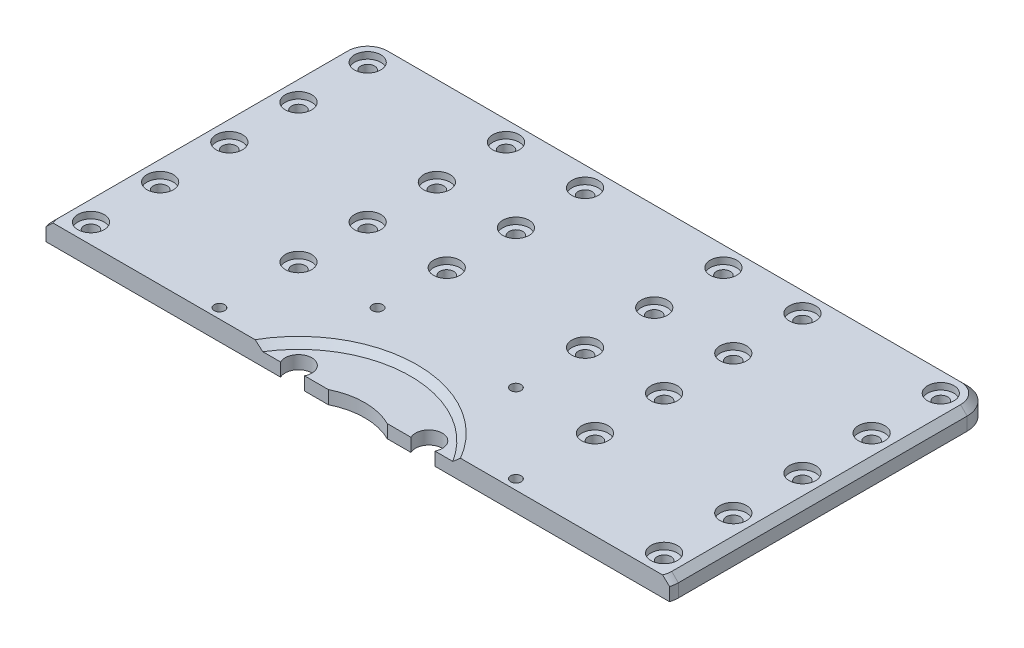
from build123d import *

# Parameters (mm, degrees)
EXTRUDE_1_DEPTH               = 3
HOLE_WIZARD_M2_1_AT_2_COUNT   = 2
HOLE_WIZARD_M2_1_AT_2_PITCH   = 21
PATTERN_LINEAR_1_COUNT        = 3
PATTERN_LINEAR_1_PITCH        = 33
PATTERN_LINEAR_2_COUNT        = 3
PATTERN_LINEAR_2_PITCH        = 10.5
PATTERN_LINEAR_3_COUNT        = 2
PATTERN_LINEAR_3_PITCH        = 31.5
HOLE_WIZARD_M2_1_2_AT_2_COUNT = 2
HOLE_WIZARD_M2_1_2_AT_2_PITCH = 16.970562748
SKETCH_8_R                    = 17
CUT_EXTRUDE_1_DEPTH           = 1
SKETCH_9_R                    = 2.025
CUT_EXTRUDE_2_DEPTH           = 75.994999833
PATTERN_CIRCULAR_1_COUNT      = 2
PATTERN_CIRCULAR_1_ANGLE      = 90
FILLET_1_R                    = 4
CHAMFER_1_SIZE                = 1
SKETCH_11_W                   = 95
SKETCH_11_H                   = 18
CUT_EXTRUDE_3_DEPTH           = 76.028327984


with BuildPart() as part:
    # ｽｹｯﾁ1 → ﾎﾞｽ - 押し出し1 (new body)
    with BuildSketch(Plane(origin=(0, 0, 0), x_dir=(1, 0, 0), z_dir=(0, 1, 0))):
        with BuildLine():
            Line((-10.05, 0), (-39, 0))
            Line((-39, 0), (-47.5, 8.5))
            Line((-47.5, 8.5), (-47.5, 58))
            Line((-47.5, 58), (47.5, 58))
            Line((47.5, 58), (47.5, 8.5))
            Line((47.5, 8.5), (39, 0))
            Line((39, 0), (10.05, 0))
            ThreePointArc((10.05, 0), (0, 10.05), (-10.05, 0))
        make_face()
    extrude(amount=EXTRUDE_1_DEPTH)

    # ｽｹｯﾁ3 → Hole Wizard M2 _1 (revolve, cut)
    with BuildSketch(Plane(origin=(-43.5, 3, -54), x_dir=(0, 0, 1), z_dir=(1, 0, 0))):
        Polygon((0, 0), (0, 4.63090365), (1.05, 4), (1.05, 1), (2, 1), (2, 0), align=None)
    hole_wizard_m2_1 = revolve(axis=Axis((-43.5, 9.35, -54), (0, -1, 0)), mode=Mode.SUBTRACT)

    # Hole Wizard M2 _1 at 2: Hole Wizard M2 _1 ×2
    with Locations(*[(i * HOLE_WIZARD_M2_1_AT_2_PITCH, 0, 0) for i in range(1, HOLE_WIZARD_M2_1_AT_2_COUNT)]):
        add(hole_wizard_m2_1, mode=Mode.SUBTRACT)

    # 直線ﾊﾟﾀｰﾝ1: Hole Wizard M2 _1 ×3
    with Locations(*[(i * PATTERN_LINEAR_1_PITCH, 0, 0) for i in range(1, PATTERN_LINEAR_1_COUNT)]):
        add(hole_wizard_m2_1, mode=Mode.SUBTRACT)

    # 直線ﾊﾟﾀｰﾝ1 copy 1 sketch → 直線ﾊﾟﾀｰﾝ1 copy 1 (revolve, cut)
    with BuildSketch(Plane(origin=(10.5, 3, -54), x_dir=(0, 0, 1), z_dir=(1, 0, 0))):
        Polygon((0, 0), (0, 4.63090365), (1.05, 4), (1.05, 1), (2, 1), (2, 0), align=None)
    revolve(axis=Axis((10.5, 9.35, -54), (0, -1, 0)), mode=Mode.SUBTRACT)

    # 直線ﾊﾟﾀｰﾝ1 copy 2 sketch → 直線ﾊﾟﾀｰﾝ1 copy 2 (revolve, cut)
    with BuildSketch(Plane(origin=(43.5, 3, -54), x_dir=(0, 0, 1), z_dir=(1, 0, 0))):
        Polygon((0, 0), (0, 4.63090365), (1.05, 4), (1.05, 1), (2, 1), (2, 0), align=None)
    revolve(axis=Axis((43.5, 9.35, -54), (0, -1, 0)), mode=Mode.SUBTRACT)

    # 直線ﾊﾟﾀｰﾝ2: Hole Wizard M2 _1 ×3
    with Locations(*[(0, 0, i * PATTERN_LINEAR_2_PITCH) for i in range(1, PATTERN_LINEAR_2_COUNT)]):
        add(hole_wizard_m2_1, mode=Mode.SUBTRACT)

    # 直線ﾊﾟﾀｰﾝ2 copy 1 sketch → 直線ﾊﾟﾀｰﾝ2 copy 1 (revolve, cut)
    with BuildSketch(Plane(origin=(-22.5, 3, -43.5), x_dir=(0, 0, 1), z_dir=(1, 0, 0))):
        Polygon((0, 0), (0, 4.63090365), (1.05, 4), (1.05, 1), (2, 1), (2, 0), align=None)
    revolve(axis=Axis((-22.5, 9.35, -43.5), (0, -1, 0)), mode=Mode.SUBTRACT)

    # 直線ﾊﾟﾀｰﾝ2 copy 2 sketch → 直線ﾊﾟﾀｰﾝ2 copy 2 (revolve, cut)
    with BuildSketch(Plane(origin=(-22.5, 3, -33), x_dir=(0, 0, 1), z_dir=(1, 0, 0))):
        Polygon((0, 0), (0, 4.63090365), (1.05, 4), (1.05, 1), (2, 1), (2, 0), align=None)
    revolve(axis=Axis((-22.5, 9.35, -33), (0, -1, 0)), mode=Mode.SUBTRACT)

    # 直線ﾊﾟﾀｰﾝ2 copy 3 sketch → 直線ﾊﾟﾀｰﾝ2 copy 3 (revolve, cut)
    with BuildSketch(Plane(origin=(-10.5, 3, -43.5), x_dir=(0, 0, 1), z_dir=(1, 0, 0))):
        Polygon((0, 0), (0, 4.63090365), (1.05, 4), (1.05, 1), (2, 1), (2, 0), align=None)
    revolve(axis=Axis((-10.5, 9.35, -43.5), (0, -1, 0)), mode=Mode.SUBTRACT)

    # 直線ﾊﾟﾀｰﾝ2 copy 4 sketch → 直線ﾊﾟﾀｰﾝ2 copy 4 (revolve, cut)
    with BuildSketch(Plane(origin=(-10.5, 3, -33), x_dir=(0, 0, 1), z_dir=(1, 0, 0))):
        Polygon((0, 0), (0, 4.63090365), (1.05, 4), (1.05, 1), (2, 1), (2, 0), align=None)
    revolve(axis=Axis((-10.5, 9.35, -33), (0, -1, 0)), mode=Mode.SUBTRACT)

    # 直線ﾊﾟﾀｰﾝ2 copy 5 sketch → 直線ﾊﾟﾀｰﾝ2 copy 5 (revolve, cut)
    with BuildSketch(Plane(origin=(22.5, 3, -43.5), x_dir=(0, 0, 1), z_dir=(1, 0, 0))):
        Polygon((0, 0), (0, 4.63090365), (1.05, 4), (1.05, 1), (2, 1), (2, 0), align=None)
    revolve(axis=Axis((22.5, 9.35, -43.5), (0, -1, 0)), mode=Mode.SUBTRACT)

    # 直線ﾊﾟﾀｰﾝ2 copy 6 sketch → 直線ﾊﾟﾀｰﾝ2 copy 6 (revolve, cut)
    with BuildSketch(Plane(origin=(22.5, 3, -33), x_dir=(0, 0, 1), z_dir=(1, 0, 0))):
        Polygon((0, 0), (0, 4.63090365), (1.05, 4), (1.05, 1), (2, 1), (2, 0), align=None)
    revolve(axis=Axis((22.5, 9.35, -33), (0, -1, 0)), mode=Mode.SUBTRACT)

    # 直線ﾊﾟﾀｰﾝ2 copy 7 sketch → 直線ﾊﾟﾀｰﾝ2 copy 7 (revolve, cut)
    with BuildSketch(Plane(origin=(10.5, 3, -43.5), x_dir=(0, 0, 1), z_dir=(1, 0, 0))):
        Polygon((0, 0), (0, 4.63090365), (1.05, 4), (1.05, 1), (2, 1), (2, 0), align=None)
    revolve(axis=Axis((10.5, 9.35, -43.5), (0, -1, 0)), mode=Mode.SUBTRACT)

    # 直線ﾊﾟﾀｰﾝ2 copy 8 sketch → 直線ﾊﾟﾀｰﾝ2 copy 8 (revolve, cut)
    with BuildSketch(Plane(origin=(10.5, 3, -33), x_dir=(0, 0, 1), z_dir=(1, 0, 0))):
        Polygon((0, 0), (0, 4.63090365), (1.05, 4), (1.05, 1), (2, 1), (2, 0), align=None)
    revolve(axis=Axis((10.5, 9.35, -33), (0, -1, 0)), mode=Mode.SUBTRACT)

    # 直線ﾊﾟﾀｰﾝ2 copy 9 sketch → 直線ﾊﾟﾀｰﾝ2 copy 9 (revolve, cut)
    with BuildSketch(Plane(origin=(43.5, 3, -43.5), x_dir=(0, 0, 1), z_dir=(1, 0, 0))):
        Polygon((0, 0), (0, 4.63090365), (1.05, 4), (1.05, 1), (2, 1), (2, 0), align=None)
    revolve(axis=Axis((43.5, 9.35, -43.5), (0, -1, 0)), mode=Mode.SUBTRACT)

    # 直線ﾊﾟﾀｰﾝ2 copy 10 sketch → 直線ﾊﾟﾀｰﾝ2 copy 10 (revolve, cut)
    with BuildSketch(Plane(origin=(43.5, 3, -33), x_dir=(0, 0, 1), z_dir=(1, 0, 0))):
        Polygon((0, 0), (0, 4.63090365), (1.05, 4), (1.05, 1), (2, 1), (2, 0), align=None)
    revolve(axis=Axis((43.5, 9.35, -33), (0, -1, 0)), mode=Mode.SUBTRACT)

    # 直線ﾊﾟﾀｰﾝ3: Hole Wizard M2 _1 ×2
    with Locations(*[(0, 0, i * PATTERN_LINEAR_3_PITCH) for i in range(1, PATTERN_LINEAR_3_COUNT)]):
        add(hole_wizard_m2_1, mode=Mode.SUBTRACT)

    # 直線ﾊﾟﾀｰﾝ3 copy 1 sketch → 直線ﾊﾟﾀｰﾝ3 copy 1 (revolve, cut)
    with BuildSketch(Plane(origin=(-22.5, 3, -22.5), x_dir=(0, 0, 1), z_dir=(1, 0, 0))):
        Polygon((0, 0), (0, 4.63090365), (1.05, 4), (1.05, 1), (2, 1), (2, 0), align=None)
    revolve(axis=Axis((-22.5, 9.35, -22.5), (0, -1, 0)), mode=Mode.SUBTRACT)

    # ｽｹｯﾁ5 → Hole Wizard M2 _1 2 (revolve, cut)
    with BuildSketch(Plane(origin=(-10.5, 3, -22.5), x_dir=(0, 0, 1), z_dir=(1, 0, 0))):
        Polygon((0, 0), (0, 6.480688495), (0.8, 6), (0.8, 0), align=None)
    hole_wizard_m2_1_2 = revolve(axis=Axis((-10.5, 9.35, -22.5), (0, -1, 0)), mode=Mode.SUBTRACT)

    # Hole Wizard M2 _1 2 at 2: Hole Wizard M2 _1 2 ×2
    with Locations(*[Vector(-0.7071067811865469, 0, 0.7071067811865482) * (i * HOLE_WIZARD_M2_1_2_AT_2_PITCH) for i in range(1, HOLE_WIZARD_M2_1_2_AT_2_COUNT)]):
        add(hole_wizard_m2_1_2, mode=Mode.SUBTRACT)

    # ｽｹｯﾁ7 → M2 なべ頭ねじ用座ぐり穴2 (revolve, cut)
    with BuildSketch(Plane(origin=(-43.5, 3, -12), x_dir=(0, 0, 1), z_dir=(1, 0, 0))):
        Polygon((0, 0), (0, 6.63090365), (1.05, 6), (1.05, 1), (2, 1), (2, 0), align=None)
    hole_wizard_m2_2 = revolve(axis=Axis((-43.5, 9.35, -12), (0, -1, 0)), mode=Mode.SUBTRACT)

    # ﾐﾗｰ1: Hole Wizard M2 _1 2, M2 なべ頭ねじ用座ぐり穴2 across plane
    add(hole_wizard_m2_1_2.mirror(Plane(origin=(0, 0, 0), x_dir=(0, 0, 1), z_dir=(1, 0, 0))), mode=Mode.SUBTRACT)
    add(hole_wizard_m2_2.mirror(Plane(origin=(0, 0, 0), x_dir=(0, 0, 1), z_dir=(1, 0, 0))), mode=Mode.SUBTRACT)

    # ﾐﾗｰ1 copy 1 sketch → ﾐﾗｰ1 copy 1 (revolve, cut)
    with BuildSketch(Plane(origin=(43.5, 3, -22.5), x_dir=(0, 0, 1), z_dir=(-1, 0, 0))):
        Polygon((0, 0), (0, -4.63090365), (1.05, -4), (1.05, -1), (2, -1), (2, 0), align=None)
    revolve(axis=Axis((43.5, 9.35, -22.5), (0, 1, 0)), mode=Mode.SUBTRACT)

    # ﾐﾗｰ1 copy 2 sketch → ﾐﾗｰ1 copy 2 (revolve, cut)
    with BuildSketch(Plane(origin=(22.5, 3, -22.5), x_dir=(0, 0, 1), z_dir=(-1, 0, 0))):
        Polygon((0, 0), (0, -4.63090365), (1.05, -4), (1.05, -1), (2, -1), (2, 0), align=None)
    revolve(axis=Axis((22.5, 9.35, -22.5), (0, 1, 0)), mode=Mode.SUBTRACT)

    # ﾐﾗｰ1 copy 3 sketch → ﾐﾗｰ1 copy 3 (revolve, cut)
    with BuildSketch(Plane(origin=(43.5, 3, -54), x_dir=(0, 0, 1), z_dir=(-1, 0, 0))):
        Polygon((0, 0), (0, -4.63090365), (1.05, -4), (1.05, -1), (2, -1), (2, 0), align=None)
    revolve(axis=Axis((43.5, 9.35, -54), (0, 1, 0)), mode=Mode.SUBTRACT)

    # ﾐﾗｰ1 copy 4 sketch → ﾐﾗｰ1 copy 4 (revolve, cut)
    with BuildSketch(Plane(origin=(22.5, 3, -54), x_dir=(0, 0, 1), z_dir=(-1, 0, 0))):
        Polygon((0, 0), (0, -4.63090365), (1.05, -4), (1.05, -1), (2, -1), (2, 0), align=None)
    revolve(axis=Axis((22.5, 9.35, -54), (0, 1, 0)), mode=Mode.SUBTRACT)

    # ﾐﾗｰ1 copy 5 sketch → ﾐﾗｰ1 copy 5 (revolve, cut)
    with BuildSketch(Plane(origin=(22.5, 3, -10.5), x_dir=(0, 0, 1), z_dir=(-1, 0, 0))):
        Polygon((0, 0), (0, -6.480688495), (0.8, -6), (0.8, 0), align=None)
    revolve(axis=Axis((22.5, 9.35, -10.5), (0, 1, 0)), mode=Mode.SUBTRACT)

    # ｽｹｯﾁ8 → ｶｯﾄ - 押し出し1 (cut)
    with BuildSketch(Plane(origin=(0, 3, 0), x_dir=(1, 0, 0), z_dir=(0, 1, 0))):
        Circle(SKETCH_8_R)
    extrude(amount=-CUT_EXTRUDE_1_DEPTH, mode=Mode.SUBTRACT)

    # ｽｹｯﾁ9 → ｶｯﾄ - 押し出し2 (cut, through all)
    with BuildSketch(Plane(origin=(0, 2, 0), x_dir=(1, 0, 0), z_dir=(0, 1, 0))):
        with Locations(Location((-9.899494937, 9.899494937, 0), (0, 0, 270))):
            Circle(SKETCH_9_R)
    cut_extrude_2 = extrude(amount=-CUT_EXTRUDE_2_DEPTH, mode=Mode.SUBTRACT)

    # 円形ﾊﾟﾀｰﾝ1: ｶｯﾄ - 押し出し2 ×2 about axis
    pattern_circular_1_axis = Axis((0, 3, 0), (0, -1, 0))
    for i in range(1, PATTERN_CIRCULAR_1_COUNT):
        add(cut_extrude_2.rotate(pattern_circular_1_axis, i * PATTERN_CIRCULAR_1_ANGLE / (PATTERN_CIRCULAR_1_COUNT - 1)), mode=Mode.SUBTRACT)

    # ﾌｨﾚｯﾄ1
    fillet_1_edges = [part.edges().sort_by_distance(p)[0] for p in [
        (-47.5, 1.5, -8.5),
        (-47.5, 1.5, -58),
        (47.5, 1.5, -58),
        (47.5, 1.5, -8.5),
        (39, 1.5, 0),
        (-39, 1.5, 0),
    ]]
    fillet(fillet_1_edges, radius=FILLET_1_R)

    # 面取り1
    chamfer_1_edges = [part.edges().sort_by_distance(p)[0] for p in [
        (0, 3, -17),
        (27.171572875, 3, 0),
        (38.87387948, 3, -0.30448187),
        (43.25, 3, -4.25),
        (47.19551813, 3, -8.62612052),
        (47.5, 3, -32.078427125),
        (-27.171572875, 3, 0),
        (46.328427125, 3, -56.828427125),
        (-38.87387948, 3, -0.30448187),
        (0, 3, -58),
        (-43.25, 3, -4.25),
        (-46.328427125, 3, -56.828427125),
        (-47.19551813, 3, -8.62612052),
        (-47.5, 3, -32.078427125),
    ]]
    chamfer(chamfer_1_edges, length=CHAMFER_1_SIZE - 0.0001)  # a hair under: the kernel refuses the full size

    # ｽｹｯﾁ11 → ｶｯﾄ - 押し出し3 (cut, through all)
    with BuildSketch(Plane(origin=(0, 3, 0), x_dir=(1, 0, 0), z_dir=(0, 1, 0))):
        Rectangle(SKETCH_11_W, SKETCH_11_H)
    extrude(amount=-CUT_EXTRUDE_3_DEPTH, mode=Mode.SUBTRACT)


solid = part.part
